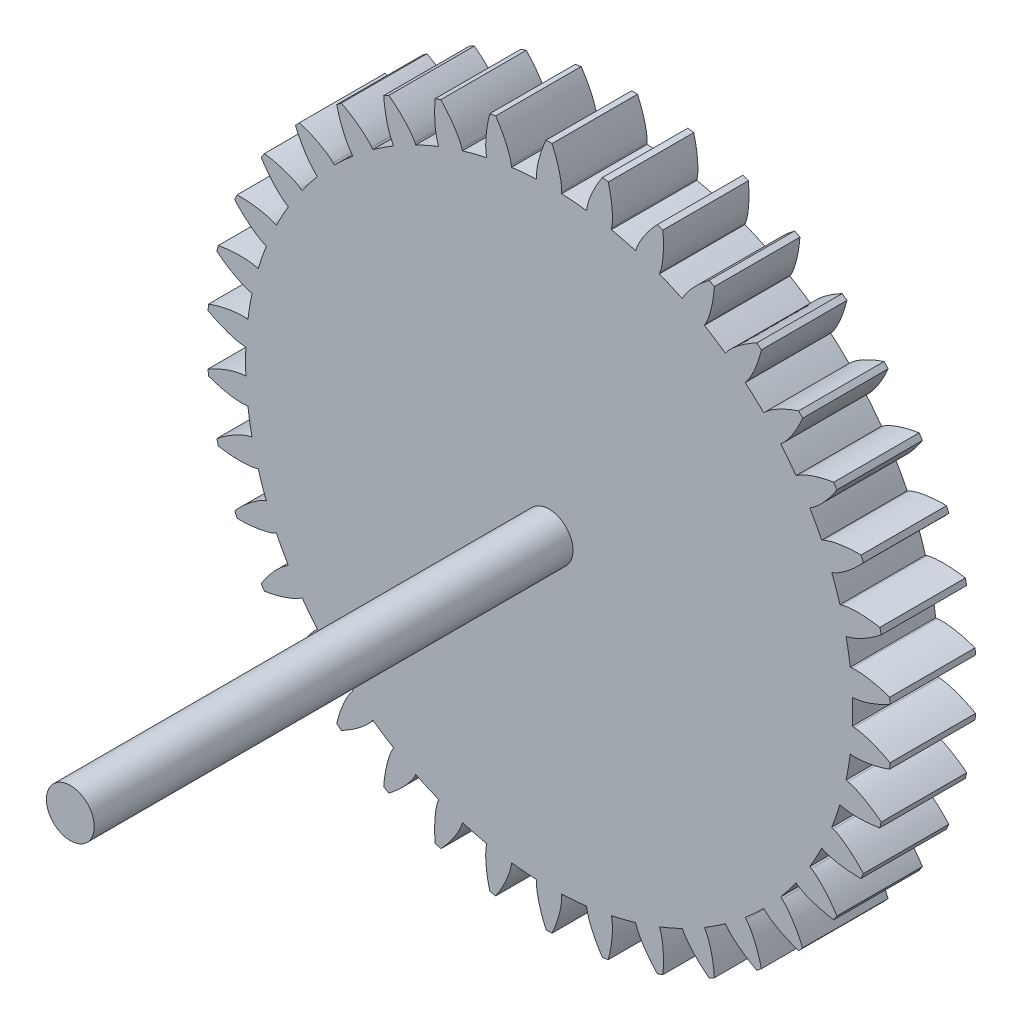
from build123d import *

# Parameters (mm, degrees)
SKETCH_1_R               = 4
SKETCH_1_R_2             = 1.4
EXTRUDE_1_DEPTH          = 5
CUT_EXTRUDE_1_DEPTH      = 8.549834435
PATTERN_CIRCULAR_1_COUNT = 6
PATTERN_CIRCULAR_1_ANGLE = 300
SKETCH_2_R               = 20
SKETCH_2_R_2             = 1.4
EXTRUDE_2_DEPTH          = 5
CUT_EXTRUDE_3_DEPTH      = 29.722813389
PATTERN_CIRCULAR_2_COUNT = 38
SKETCH_3_R               = 1.4
EXTRUDE_3_DEPTH          = 28
EXTRUDE_START            = -15
SKETCH_3_2_R             = 1.4
EXTRUDE_4_DEPTH          = 15


with BuildPart() as part:
    # 草图1 → 凸台-拉伸1 (new body)
    with BuildSketch(Plane.XY):
        Circle(SKETCH_1_R)
        Circle(SKETCH_1_R_2, mode=Mode.SUBTRACT)
    extrude(amount=EXTRUDE_1_DEPTH)

    # 草图1<3> → 切除-拉伸1 (cut, through all)
    with BuildSketch(Plane.XY):
        with BuildLine():
            Line((2.730540893, 0.700961074), (1.695038873, 0.435135863))
            ThreePointArc((1.695038873, 0.435135863), (1.736205349, 0.219296571), (1.75, 0))
            ThreePointArc((1.75, 0), (1.736205349, -0.219296571), (1.695038873, -0.435135863))
            Line((1.695038873, -0.435135863), (2.730540893, -0.700961074))
            add(Edge.make_bspline(
                [(2.730540893, -0.700961074), (2.751355068, -0.706304311), (2.808329953, -0.725541446), (2.910522768, -0.778982289), (3.06267796, -0.887491262), (3.235956594, -1.057334282), (3.408810129, -1.2831446), (3.52264255, -1.482702951), (3.589508983, -1.625182096), (3.620975996, -1.699568426)],
                knots=[0, 0, 0, 0, 0, 0.005604068, 0.015718248, 0.029959916, 0.048733667, 0.068727063, 0.089838728, 0.089838728, 0.089838728, 0.089838728, 0.089838728], degree=4))
            ThreePointArc((3.620975996, -1.699568426), (3.90409426, -0.870659525), (4, 0))
            ThreePointArc((4, 0), (3.90409426, 0.870659525), (3.620975996, 1.699568426))
            add(Edge.make_bspline(
                [(2.730540893, 0.700961074), (2.751355068, 0.706304311), (2.808329953, 0.725541446), (2.910522768, 0.778982289), (3.06267796, 0.887491262), (3.235956594, 1.057334282), (3.408810129, 1.2831446), (3.52264255, 1.482702951), (3.589508983, 1.625182096), (3.620975996, 1.699568426)],
                knots=[0, 0, 0, 0, 0, 0.005604068, 0.015718248, 0.029959916, 0.048733667, 0.068727063, 0.089838728, 0.089838728, 0.089838728, 0.089838728, 0.089838728], degree=4))
        make_face()
    cut_extrude_1 = extrude(amount=CUT_EXTRUDE_1_DEPTH, mode=Mode.SUBTRACT)

    # 阵列(圆周)1: 切除-拉伸1 ×6 about axis
    pattern_circular_1_axis = Axis((0, 0, 5), (0, 0, 1))
    for i in range(1, PATTERN_CIRCULAR_1_COUNT):
        add(cut_extrude_1.rotate(pattern_circular_1_axis, i * PATTERN_CIRCULAR_1_ANGLE / (PATTERN_CIRCULAR_1_COUNT - 1)), mode=Mode.SUBTRACT)

    # 草图2 → 凸台-拉伸2 (add)
    with BuildSketch(Plane.XY.offset(5)):
        Circle(SKETCH_2_R)
        Circle(SKETCH_2_R_2, mode=Mode.SUBTRACT)
    extrude(amount=EXTRUDE_2_DEPTH)

    # 草图2<3> → 切除-拉伸3 (cut, through all)
    with BuildSketch(Plane.XY.offset(5)):
        with BuildLine():
            Line((17.838908029, 0.737822694), (17.734837211, 0.733518293))
            ThreePointArc((17.734837211, 0.733518293), (17.746208898, 0.366837497), (17.75, 0))
            ThreePointArc((17.75, 0), (17.746208898, -0.366837497), (17.734837211, -0.733518293))
            Line((17.734837211, -0.733518293), (17.838908029, -0.737822694))
            add(Edge.make_bspline(
                [(17.838908029, -0.737822694), (17.872849269, -0.739226514), (17.940552494, -0.744118754), (18.075241986, -0.762138409), (18.328810536, -0.812273342), (18.66347973, -0.90508771), (19.120548858, -1.070237387), (19.508851941, -1.247313895), (19.778857482, -1.386865325), (19.937601681, -1.474433608), (19.945263252, -1.478672992)],
                knots=[0, 0, 0, 0, 0, 0.001401017, 0.002802034, 0.005604068, 0.010661158, 0.015718248, 0.022839082, 0.023200461, 0.023200461, 0.023200461, 0.023200461, 0.023200461], degree=4))
            ThreePointArc((19.945263252, -1.478672992), (19.986311128, -0.739842877), (20, 0))
            ThreePointArc((20, 0), (19.986311128, 0.739842877), (19.945263252, 1.478672992))
            add(Edge.make_bspline(
                [(17.838908029, 0.737822694), (17.872849269, 0.739226514), (17.940552494, 0.744118754), (18.075241986, 0.762138409), (18.328810536, 0.812273342), (18.66347973, 0.90508771), (19.120548858, 1.070237387), (19.508851941, 1.247313895), (19.778857482, 1.386865325), (19.937601681, 1.474433608), (19.945263252, 1.478672992)],
                knots=[0, 0, 0, 0, 0, 0.001401017, 0.002802034, 0.005604068, 0.010661158, 0.015718248, 0.022839082, 0.023200461, 0.023200461, 0.023200461, 0.023200461, 0.023200461], degree=4))
        make_face()
    cut_extrude_3 = extrude(amount=CUT_EXTRUDE_3_DEPTH, mode=Mode.SUBTRACT)

    # 阵列(圆周)2: 切除-拉伸3 ×38 about axis
    pattern_circular_2_axis = Axis((0, 0, 10), (0, 0, 1))
    for i in range(1, PATTERN_CIRCULAR_2_COUNT):
        add(cut_extrude_3.rotate(pattern_circular_2_axis, i * 360 / PATTERN_CIRCULAR_2_COUNT), mode=Mode.SUBTRACT)



with BuildPart() as body_2:
    # 草图3 → 凸台-拉伸3 (new body)
    with BuildSketch(Plane.XY.offset(10)):
        Circle(SKETCH_3_R)
    extrude(amount=EXTRUDE_3_DEPTH)


with BuildPart() as part_1:
    add(part.part)

    add(body_2.part)  # 凸台-拉伸4 merges body 2
    # 草图3<2> → 凸台-拉伸4 (add)
    with BuildSketch(Plane.XY.offset(10).offset(EXTRUDE_START)):
        Circle(SKETCH_3_2_R)
    extrude(amount=EXTRUDE_4_DEPTH)


solid = part_1.part
